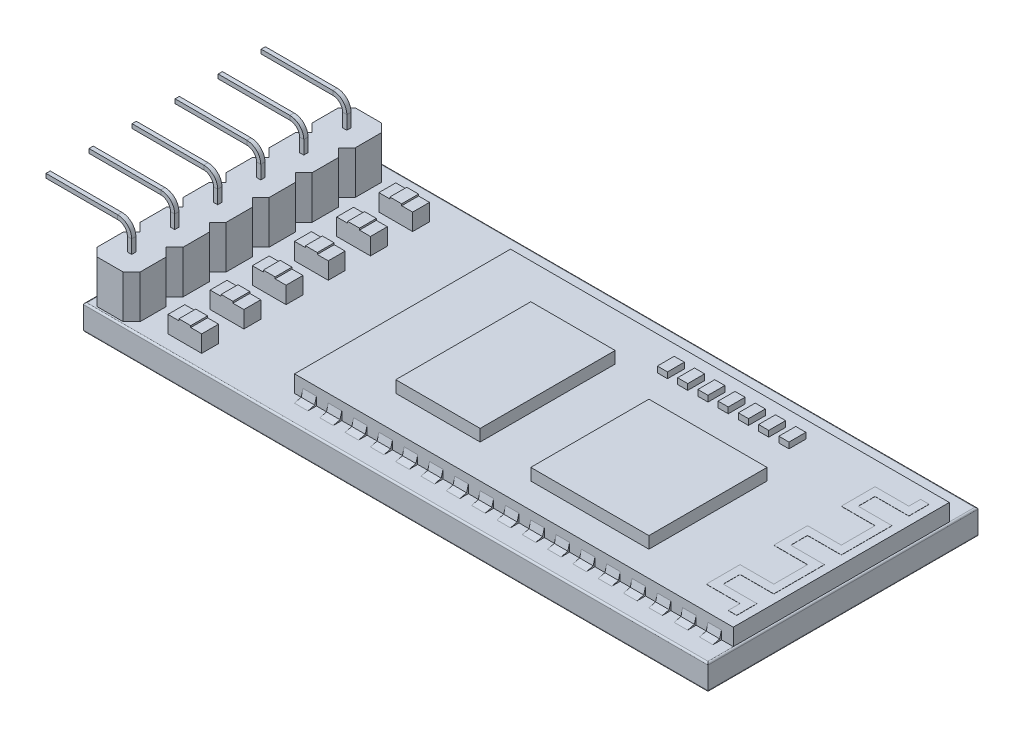
from build123d import *

# Parameters (mm, degrees)
SKETCH1_W                  = 37
SKETCH1_H                  = 16
BOSS_EXTRUDE1_DEPTH        = 1.5
BOSS_EXTRUDE2_DEPTH        = 2.55
LPATTERN1_COUNT            = 6
LPATTERN1_PITCH            = 2.55
SKETCH5_W                  = 0.25
SKETCH5_H                  = 0.25
CHAMFER1_SIZE              = 0.05
LPATTERN2_COUNT            = 6
LPATTERN2_PITCH            = 2.55
CHAMFER1_OF_LPATTERN2_SIZE = 0.05
FILLET1_R                  = 0.1
SKETCH6_W                  = 26
SKETCH6_H                  = 12.8
BOSS_EXTRUDE3_DEPTH        = 1
BOSS_EXTRUDE4_START        = -0.5
BOSS_EXTRUDE4_DEPTH        = 0.8
LPATTERN3_COUNT            = 17
LPATTERN3_PITCH            = 1.5
BOSS_EXTRUDE5_DEPTH        = 0.01
SKETCH9_W                  = 2
SKETCH9_H                  = 1
BOSS_EXTRUDE6_DEPTH        = 1
SKETCH10_W                 = 0.7
SKETCH10_H                 = 1
BOSS_EXTRUDE7_DEPTH        = 0.1
LPATTERN4_COUNT            = 6
LPATTERN4_PITCH            = 2.5
SKETCH11_W                 = 5
SKETCH11_H                 = 8
SKETCH11_W_2               = 7
SKETCH11_H_2               = 7
BOSS_EXTRUDE8_DEPTH        = 0.7
SKETCH12_W                 = 0.6
SKETCH12_H                 = 1
BOSS_EXTRUDE9_DEPTH        = 0.35
LPATTERN5_COUNT            = 7
LPATTERN5_PITCH            = 1.2


with BuildPart() as part:
    # Sketch1 → Boss-Extrude1 (new body)
    with BuildSketch(Plane(origin=(0, 0, 0), x_dir=(1, 0, 0), z_dir=(0, 1, 0))):
        Rectangle(SKETCH1_W, SKETCH1_H)
    extrude(amount=BOSS_EXTRUDE1_DEPTH)

    # Sketch2 → Boss-Extrude2 (add)
    with BuildSketch(Plane(origin=(0, 1.5, 0), x_dir=(1, 0, 0), z_dir=(0, 1, 0))):
        Polygon((-17.9, 4.95), (-16.35, 4.95), (-15.85, 5.45), (-15.85, 7), (-16.35, 7.5), (-17.9, 7.5), (-18.4, 7), (-18.4, 5.45), align=None)
    boss_extrude2 = extrude(amount=BOSS_EXTRUDE2_DEPTH)

    # LPattern1: Boss-Extrude2 ×6
    with Locations(*[(0, 0, i * LPATTERN1_PITCH) for i in range(1, LPATTERN1_COUNT)]):
        add(boss_extrude2)

    # Sweep1: sweep along a path in Sketch4
    with BuildLine(Plane(origin=(0, 0, -6.225), x_dir=(-1, 0, 0), z_dir=(0, 0, -1))) as sweep1_path:
        Line((17.125, 4.05), (17.125, 4.85))
        ThreePointArc((17.125, 4.85), (17.330025253, 5.344974747), (17.825, 5.55))
        Line((17.825, 5.55), (22.125, 5.55))
    # Sketch5 → Sweep1 (sweep)
    with BuildSketch(Plane(origin=(0, 4.05, 0), x_dir=(1, 0, 0), z_dir=(0, 1, 0))):
        with Locations((-17.125, 6.225)):
            Rectangle(SKETCH5_W, SKETCH5_H)
    sweep1 = sweep(path=sweep1_path.line)

    # Chamfer1
    chamfer1_edges = [part.edges().sort_by_distance(p)[0] for p in [
        (-22.125, 5.675, -6.225),
        (-22.125, 5.55, -6.35),
        (-22.125, 5.425, -6.225),
        (-22.125, 5.55, -6.1),
    ]]
    chamfer(chamfer1_edges, length=CHAMFER1_SIZE)

    # LPattern2: Sweep1 ×6
    with Locations(*[(0, 0, i * LPATTERN2_PITCH) for i in range(1, LPATTERN2_COUNT)]):
        add(sweep1)

    # Chamfer1 of LPattern2
    chamfer1_of_lpattern2_edges = [part.edges().sort_by_distance(p)[0] for p in [
        (-22.125, 5.675, -3.675),
        (-22.125, 5.55, -3.8),
        (-22.125, 5.425, -3.675),
        (-22.125, 5.55, -3.55),
        (-22.125, 5.675, -1.125),
        (-22.125, 5.55, -1.25),
        (-22.125, 5.425, -1.125),
        (-22.125, 5.55, -1),
        (-22.125, 5.675, 1.425),
        (-22.125, 5.55, 1.3),
        (-22.125, 5.425, 1.425),
        (-22.125, 5.55, 1.55),
        (-22.125, 5.675, 3.975),
        (-22.125, 5.55, 3.85),
        (-22.125, 5.425, 3.975),
        (-22.125, 5.55, 4.1),
        (-22.125, 5.675, 6.525),
        (-22.125, 5.55, 6.4),
        (-22.125, 5.425, 6.525),
        (-22.125, 5.55, 6.65),
    ]]
    chamfer(chamfer1_of_lpattern2_edges, length=CHAMFER1_OF_LPATTERN2_SIZE)

    # Fillet1
    fillet1_edges = [part.edges().sort_by_distance(p)[0] for p in [
        (-18.5, 1.5, 0),
        (0, 1.5, 8),
        (18.5, 1.5, 0),
        (0, 0, 8),
        (-18.5, 0, 0),
        (0, 0, -8),
        (18.5, 0, 0),
        (0, 1.5, -8),
    ]]
    fillet(fillet1_edges, radius=FILLET1_R - 0.0001)  # a hair under: the kernel refuses the full size

    # Sketch6 → Boss-Extrude3 (add)
    with BuildSketch(Plane(origin=(0, 1.5, 0), x_dir=(1, 0, 0), z_dir=(0, 1, 0))):
        with Locations((5.4, 0)):
            Rectangle(SKETCH6_W, SKETCH6_H)
    extrude(amount=BOSS_EXTRUDE3_DEPTH)

    # Sketch7 → Boss-Extrude4 (add)
    with BuildSketch(Plane.ZY.offset(7.6).offset(BOSS_EXTRUDE4_START)):
        Polygon((-6.904312875, 1.5), (-6.504312875, 1.6), (-6.4, 2), (-6.4, 1.5), align=None)
        Polygon((6.4, 1.5), (6.4, 2), (6.504312875, 1.6), (6.904312875, 1.5), align=None)
    boss_extrude4 = extrude(amount=-BOSS_EXTRUDE4_DEPTH)

    # LPattern3: Boss-Extrude4 ×17
    with Locations(*[(i * LPATTERN3_PITCH, 0, 0) for i in range(1, LPATTERN3_COUNT)]):
        add(boss_extrude4)

    # Sketch8 → Boss-Extrude5 (add)
    with BuildSketch(Plane(origin=(0, 2.5, 0), x_dir=(1, 0, 0), z_dir=(0, 1, 0))):
        Polygon((17.4, -5.7), (17.4, -5), (15.4, -5), (15.4, -3), (17.4, -3), (17.4, -1), (15.4, -1), (15.4, 0), (15.4, 1), (17.4, 1), (17.4, 3), (15.4, 3), (15.4, 5), (17.4, 5), (17.4, 5.7), (17.9, 5.7), (17.9, 4.5), (15.9, 4.5), (15.9, 3.5), (17.9, 3.5), (17.9, 0.5), (15.9, 0.5), (15.9, 0), (15.9, -0.5), (17.9, -0.5), (17.9, -3.5), (15.9, -3.5), (15.9, -4.5), (17.9, -4.5), (17.9, -5.7), align=None)
    extrude(amount=BOSS_EXTRUDE5_DEPTH)

    # Sketch9 → Boss-Extrude6 (add)
    with BuildSketch(Plane(origin=(0, 1.5, 0), x_dir=(1, 0, 0), z_dir=(0, 1, 0))):
        with Locations((-13.4, 5.9)):
            Rectangle(SKETCH9_W, SKETCH9_H)
    boss_extrude6 = extrude(amount=BOSS_EXTRUDE6_DEPTH)

    # Sketch10 → Boss-Extrude7 (add)
    with BuildSketch(Plane(origin=(0, 2.5, 0), x_dir=(1, 0, 0), z_dir=(0, 1, 0))):
        with Locations((-13.4, 5.9)):
            Rectangle(SKETCH10_W, SKETCH10_H)
    boss_extrude7 = extrude(amount=BOSS_EXTRUDE7_DEPTH)

    # LPattern4: Boss-Extrude6, Boss-Extrude7 ×6
    with Locations(*[(0, 0, i * LPATTERN4_PITCH) for i in range(1, LPATTERN4_COUNT)]):
        add(boss_extrude6)
        add(boss_extrude7)

    # Sketch11 → Boss-Extrude8 (add)
    with BuildSketch(Plane(origin=(0, 2.5, 0), x_dir=(1, 0, 0), z_dir=(0, 1, 0))):
        with Locations((-1.1, -0.4)):
            Rectangle(SKETCH11_W, SKETCH11_H)
        with Locations((8.4, -1.4)):
            Rectangle(SKETCH11_W_2, SKETCH11_H_2)
    extrude(amount=BOSS_EXTRUDE8_DEPTH)

    # Sketch12 → Boss-Extrude9 (add)
    with BuildSketch(Plane(origin=(0, 2.5, 0), x_dir=(1, 0, 0), z_dir=(0, 1, 0))):
        with Locations((3.4, 4.9)):
            Rectangle(SKETCH12_W, SKETCH12_H)
    boss_extrude9 = extrude(amount=BOSS_EXTRUDE9_DEPTH)

    # LPattern5: Boss-Extrude9 ×7
    with Locations(*[(i * LPATTERN5_PITCH, 0, 0) for i in range(1, LPATTERN5_COUNT)]):
        add(boss_extrude9)


solid = part.part
